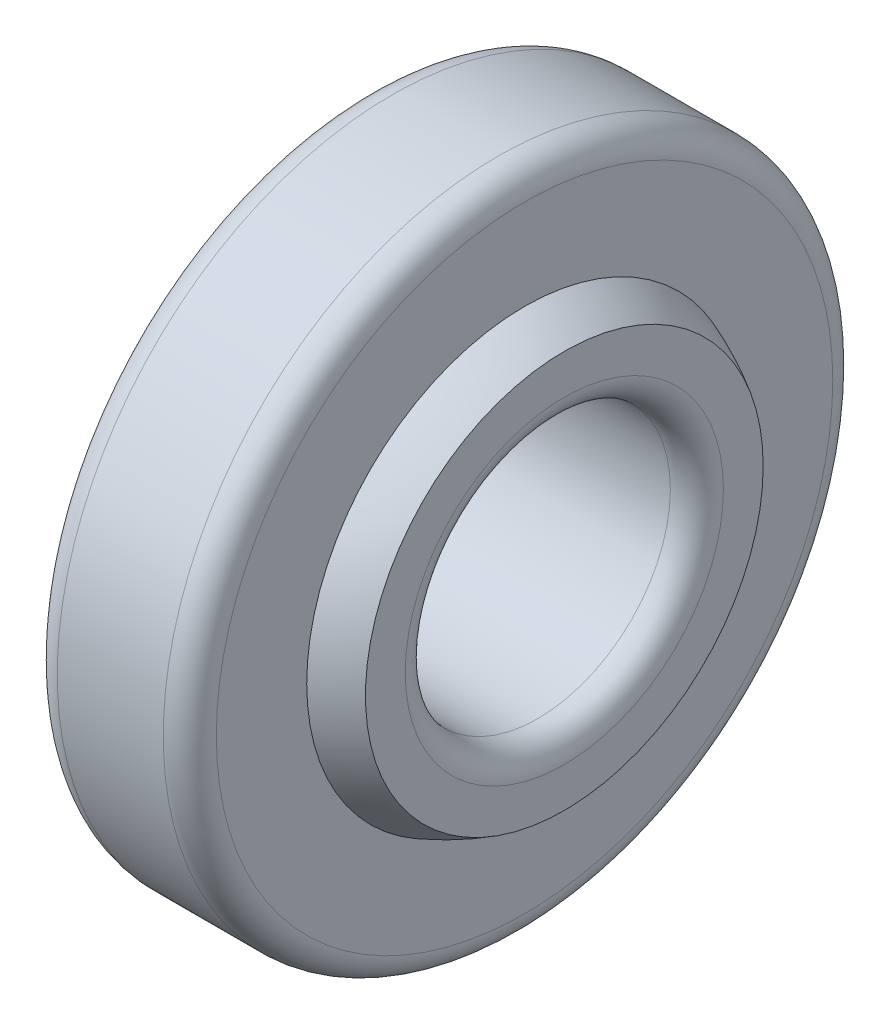
from build123d import *

# Parameters (mm, degrees)
FILLET1_R = 0.2


with BuildPart() as part:
    # Sketch1 → Revolve1 (revolve)
    with BuildSketch(Plane(origin=(0, 0, 0), x_dir=(1, 0, 0), z_dir=(0, 1, 0))):
        with BuildLine():
            Line((0.6, 2.525), (-0.6, 2.525))
            Line((-0.6, 2.525), (-0.6, 1.643167673))
            ThreePointArc((-0.6, 1.643167673), (-0.753408419, 1.578725991), (-0.9, 1.5))
            Line((-0.9, 1.5), (-0.9, 1))
            Line((-0.9, 1), (0.9, 1))
            Line((0.9, 1), (0.9, 1.5))
            ThreePointArc((0.9, 1.5), (0.753408419, 1.578725991), (0.6, 1.643167673))
            Line((0.6, 1.643167673), (0.6, 2.525))
        make_face()
    revolve(axis=Axis((0, 0, 0), (1, 0, 0)))

    # Fillet1
    fillet1_edges = [part.edges().sort_by_distance(p)[0] for p in [
        (-0.9, 0, 1),
        (0.9, 0, 1),
        (-0.6, 0, 2.525),
        (0.6, 0, 2.525),
    ]]
    fillet(fillet1_edges, radius=FILLET1_R)


solid = part.part
